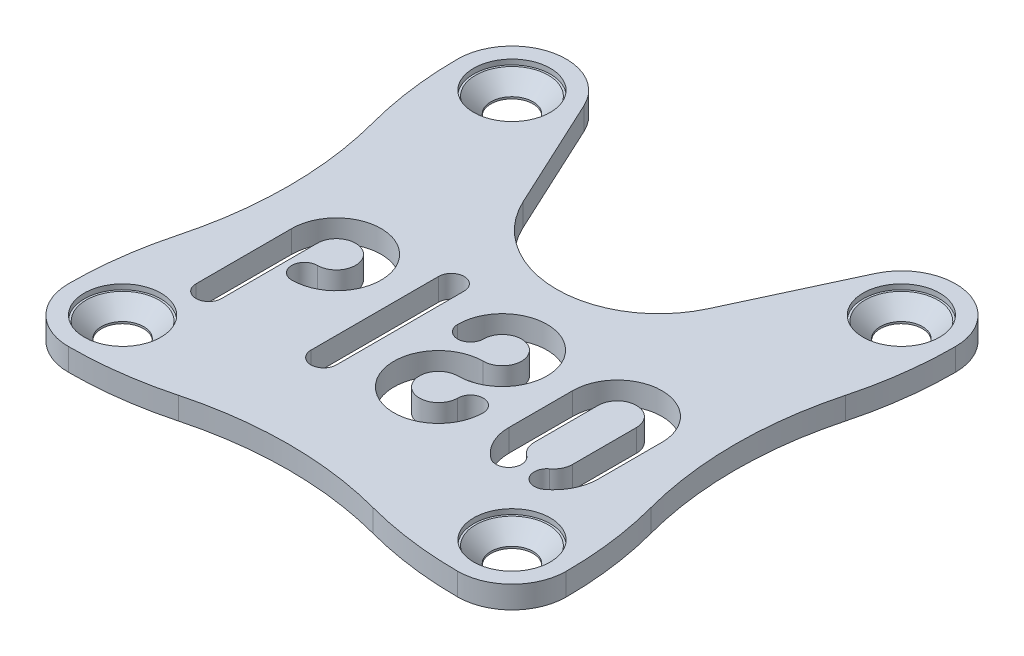
from build123d import *

# Parameters (mm, degrees)
SKETCH1_W                = 39
SKETCH1_H                = 39
SKETCH1_R                = 1.65
SHAPE_DEPTH              = 1.75
CAMERA_CUT_REACH         = 29.633
SKETCH4_R                = 3
SCREW_HEAD_CUTS_DEPTH    = 0.4
SCREW_HEAD_CHAMFERS_SIZE = 1.2
BEAUTY_CUTS_REACH        = 29.633
NAME_REACH               = 29.633


with BuildPart() as part:
    # Sketch1 → Shape (new body)
    with BuildSketch(Plane(origin=(0, 0, 0), x_dir=(1, 0, 0), z_dir=(0, 1, 0))):
        Rectangle(SKETCH1_W, SKETCH1_H)
        with Locations((-15.25, 15.25)):
            Circle(SKETCH1_R, mode=Mode.SUBTRACT)
        with Locations((15.25, 15.25)):
            Circle(SKETCH1_R, mode=Mode.SUBTRACT)
        with Locations((-15.25, -15.25)):
            Circle(SKETCH1_R, mode=Mode.SUBTRACT)
        with Locations((15.25, -15.25)):
            Circle(SKETCH1_R, mode=Mode.SUBTRACT)
    extrude(amount=SHAPE_DEPTH)

    # Sketch2 → Camera cut (cut, up to next)
    with BuildSketch(Plane(origin=(0, 1.75, 0), x_dir=(1, 0, 0), z_dir=(0, 1, 0)), mode=Mode.PRIVATE) as camera_cut_sk1:
        with BuildLine():
            ThreePointArc((-7.255139017, 8.12910133), (0, 3.5), (7.255139017, 8.12910133))
            Line((7.255139017, 8.12910133), (11.395707531, 17.040790207))
            ThreePointArc((11.395707531, 17.040790207), (12.963994574, 18.83283117), (15.25, 19.5))
            Line((15.25, 19.5), (-15.249999971, 19.5))
            ThreePointArc((-15.249999971, 19.5), (-12.963994499, 18.832831122), (-11.395707469, 17.040790074))
            Line((-11.395707469, 17.040790074), (-7.255139017, 8.12910133))
        make_face()
    camera_cut_tool1 = extrude(camera_cut_sk1.sketch, amount=-CAMERA_CUT_REACH, mode=Mode.PRIVATE) & part.part
    # Sketch2 → Camera cut (cut, up to next)
    with BuildSketch(Plane(origin=(0, 1.75, 0), x_dir=(1, 0, 0), z_dir=(0, 1, 0)), mode=Mode.PRIVATE) as camera_cut_sk2:
        with BuildLine():
            ThreePointArc((-19.5, 15.25), (-18.25520381, 18.25520383), (-15.249999971, 19.5))
            Line((-15.249999971, 19.5), (-19.5, 19.5))
            Line((-19.5, 19.5), (-19.5, 15.25))
        make_face()
    camera_cut_tool2 = extrude(camera_cut_sk2.sketch, amount=-CAMERA_CUT_REACH, mode=Mode.PRIVATE) & part.part
    # Sketch2 → Camera cut (cut, up to next)
    with BuildSketch(Plane(origin=(0, 1.75, 0), x_dir=(1, 0, 0), z_dir=(0, 1, 0)), mode=Mode.PRIVATE) as camera_cut_sk3:
        with BuildLine():
            Line((19.5, 19.5), (15.25, 19.5))
            ThreePointArc((15.25, 19.5), (18.25520382, 18.25520382), (19.5, 15.25))
            Line((19.5, 15.25), (19.5, 19.5))
        make_face()
    camera_cut_tool3 = extrude(camera_cut_sk3.sketch, amount=-CAMERA_CUT_REACH, mode=Mode.PRIVATE) & part.part
    # Sketch2 → Camera cut (cut, up to next)
    with BuildSketch(Plane(origin=(0, 1.75, 0), x_dir=(1, 0, 0), z_dir=(0, 1, 0)), mode=Mode.PRIVATE) as camera_cut_sk4:
        with BuildLine():
            ThreePointArc((-15.25, -19.5), (-18.255203845, -18.255203795), (-19.5, -15.249999928))
            Line((-19.5, -15.249999928), (-19.5, -19.5))
            Line((-19.5, -19.5), (-15.25, -19.5))
        make_face()
    camera_cut_tool4 = extrude(camera_cut_sk4.sketch, amount=-CAMERA_CUT_REACH, mode=Mode.PRIVATE) & part.part
    # Sketch2 → Camera cut (cut, up to next)
    with BuildSketch(Plane(origin=(0, 1.75, 0), x_dir=(1, 0, 0), z_dir=(0, 1, 0)), mode=Mode.PRIVATE) as camera_cut_sk5:
        with BuildLine():
            Line((19.5, -19.5), (19.5, -15.25))
            ThreePointArc((19.5, -15.25), (18.255203817, -18.255203823), (15.249999992, -19.5))
            Line((15.249999992, -19.5), (19.5, -19.5))
        make_face()
    camera_cut_tool5 = extrude(camera_cut_sk5.sketch, amount=-CAMERA_CUT_REACH, mode=Mode.PRIVATE) & part.part
    add(camera_cut_tool1.solids().sort_by_distance((0, 1.75, -12.946988))[0], mode=Mode.SUBTRACT)
    add(camera_cut_tool2.solids().sort_by_distance((-18.550686, 1.75, -18.550686))[0], mode=Mode.SUBTRACT)
    add(camera_cut_tool3.solids().sort_by_distance((18.550686, 1.75, -18.550686))[0], mode=Mode.SUBTRACT)
    add(camera_cut_tool4.solids().sort_by_distance((-18.550686, 1.75, 18.550686))[0], mode=Mode.SUBTRACT)
    add(camera_cut_tool5.solids().sort_by_distance((18.550686, 1.75, 18.550686))[0], mode=Mode.SUBTRACT)

    # Sketch4 → Screw head cuts (cut)
    with BuildSketch(Plane(origin=(0, 1.75, 0), x_dir=(1, 0, 0), z_dir=(0, 1, 0))):
        with Locations((-15.25, 15.25)):
            Circle(SKETCH4_R)
        with Locations((15.25, 15.25)):
            Circle(SKETCH4_R)
        with Locations((15.25, -15.25)):
            Circle(SKETCH4_R)
        with Locations((-15.25, -15.25)):
            Circle(SKETCH4_R)
    extrude(amount=-SCREW_HEAD_CUTS_DEPTH, mode=Mode.SUBTRACT)

    # Screw head chamfers
    screw_head_chamfers_edges = [part.edges().sort_by_distance(p)[0] for p in [
        (-16.9, 1.35, 15.25),
        (13.6, 1.35, 15.25),
        (13.6, 1.35, -15.25),
        (-16.9, 1.35, -15.25),
    ]]
    chamfer(screw_head_chamfers_edges, length=SCREW_HEAD_CHAMFERS_SIZE)

    # Sketch5 → Beauty cuts (cut, up to next)
    with BuildSketch(Plane(origin=(0, 1.75, 0), x_dir=(1, 0, 0), z_dir=(0, 1, 0)), mode=Mode.PRIVATE) as beauty_cuts_sk1:
        with BuildLine():
            Line((-19.5, 15.25), (-19.5, -15.25))
            ThreePointArc((-19.5, -15.25), (-19.248934167, -11.404852896), (-18.5, -7.625))
            ThreePointArc((-18.5, -7.625), (-17.5, 0), (-18.5, 7.625))
            ThreePointArc((-18.5, 7.625), (-19.248934167, 11.404852896), (-19.5, 15.25))
        make_face()
    beauty_cuts_tool1 = extrude(beauty_cuts_sk1.sketch, amount=-BEAUTY_CUTS_REACH, mode=Mode.PRIVATE) & part.part
    # Sketch5 → Beauty cuts (cut, up to next)
    with BuildSketch(Plane(origin=(0, 1.75, 0), x_dir=(1, 0, 0), z_dir=(0, 1, 0)), mode=Mode.PRIVATE) as beauty_cuts_sk2:
        with BuildLine():
            Line((-15.25, -19.5), (15.25, -19.5))
            ThreePointArc((15.25, -19.5), (11.404852896, -19.248934167), (7.625, -18.5))
            ThreePointArc((7.625, -18.5), (0, -17.5), (-7.625, -18.5))
            ThreePointArc((-7.625, -18.5), (-11.404852896, -19.248934167), (-15.25, -19.5))
        make_face()
    beauty_cuts_tool2 = extrude(beauty_cuts_sk2.sketch, amount=-BEAUTY_CUTS_REACH, mode=Mode.PRIVATE) & part.part
    # Sketch5 → Beauty cuts (cut, up to next)
    with BuildSketch(Plane(origin=(0, 1.75, 0), x_dir=(1, 0, 0), z_dir=(0, 1, 0)), mode=Mode.PRIVATE) as beauty_cuts_sk3:
        with BuildLine():
            Line((19.5, -15.25), (19.5, 15.25))
            ThreePointArc((19.5, 15.25), (19.248934167, 11.404852896), (18.5, 7.625))
            ThreePointArc((18.5, 7.625), (17.5, 0), (18.5, -7.625))
            ThreePointArc((18.5, -7.625), (19.248934167, -11.404852896), (19.5, -15.25))
        make_face()
    beauty_cuts_tool3 = extrude(beauty_cuts_sk3.sketch, amount=-BEAUTY_CUTS_REACH, mode=Mode.PRIVATE) & part.part
    add(beauty_cuts_tool1.solids().sort_by_distance((-18.732027, 1.75, 0))[0], mode=Mode.SUBTRACT)
    add(beauty_cuts_tool2.solids().sort_by_distance((0, 1.75, 18.732027))[0], mode=Mode.SUBTRACT)
    add(beauty_cuts_tool3.solids().sort_by_distance((18.732027, 1.75, 0))[0], mode=Mode.SUBTRACT)

    # Sketch9 → Name (cut, up to next)
    with BuildSketch(Plane(origin=(0, 1.75, 0), x_dir=(1, 0, 0), z_dir=(0, 1, 0)), mode=Mode.PRIVATE) as name_sk1:
        with BuildLine():
            Line((-14.5, -2.75), (-14.5, -10.25))
            ThreePointArc((-14.5, -10.25), (-13.5, -11.25), (-12.5, -10.25))
            Line((-12.5, -10.25), (-12.5, -2.75))
            ThreePointArc((-12.5, -2.75), (-9.939339828, -1.689339828), (-11, -4.25))
            ThreePointArc((-11, -4.25), (-12, -5.250000005), (-10.999999989, -6.25))
            ThreePointArc((-10.999999989, -6.25), (-8.52512627, -0.275126262), (-14.5, -2.75))
        make_face()
    name_tool1 = extrude(name_sk1.sketch, amount=-NAME_REACH, mode=Mode.PRIVATE) & part.part
    # Sketch9 → Name (cut, up to next)
    with BuildSketch(Plane(origin=(0, 1.75, 0), x_dir=(1, 0, 0), z_dir=(0, 1, 0)), mode=Mode.PRIVATE) as name_sk2:
        with BuildLine():
            Line((-3.5, -10.25), (-3.5, -0.25))
            ThreePointArc((-3.5, -0.25), (-4.5, 0.75), (-5.5, -0.25))
            Line((-5.5, -0.25), (-5.5, -10.25))
            ThreePointArc((-5.5, -10.25), (-4.5, -11.25), (-3.5, -10.25))
        make_face()
    name_tool2 = extrude(name_sk2.sketch, amount=-NAME_REACH, mode=Mode.PRIVATE) & part.part
    # Sketch9 → Name (cut, up to next)
    with BuildSketch(Plane(origin=(0, 1.75, 0), x_dir=(1, 0, 0), z_dir=(0, 1, 0)), mode=Mode.PRIVATE) as name_sk3:
        with BuildLine():
            Line((7.5, -2.75), (7.5, -7.75))
            ThreePointArc((7.5, -7.75), (7.869504796, -9.315247513), (8.899999873, -10.549999905))
            ThreePointArc((8.899999873, -10.549999905), (10.299999948, -10.35000007), (10.100000013, -8.950000009))
            ThreePointArc((10.100000013, -8.950000009), (9.658359217, -8.4208204), (9.5, -7.75))
            Line((9.5, -7.75), (9.5, -2.75))
            ThreePointArc((9.5, -2.75), (11, -1.25), (12.5, -2.75))
            Line((12.5, -2.75), (12.5, -7.75))
            ThreePointArc((12.5, -7.75), (12.341640763, -8.420820441), (11.899999915, -8.950000063))
            ThreePointArc((11.899999915, -8.950000063), (11.700000022, -10.350000029), (13.099999973, -10.55000002))
            ThreePointArc((13.099999973, -10.55000002), (14.130495161, -9.315247599), (14.5, -7.75))
            Line((14.5, -7.75), (14.5, -2.75))
            ThreePointArc((14.5, -2.75), (11, 0.75), (7.5, -2.75))
        make_face()
    name_tool3 = extrude(name_sk3.sketch, amount=-NAME_REACH, mode=Mode.PRIVATE) & part.part
    # Sketch9 → Name (cut, up to next)
    with BuildSketch(Plane(origin=(0, 1.75, 0), x_dir=(1, 0, 0), z_dir=(0, 1, 0)), mode=Mode.PRIVATE) as name_sk4:
        with BuildLine():
            ThreePointArc((-1.5, -2.75), (-0.5, -3.75), (0.5, -2.75))
            ThreePointArc((0.5, -2.75), (3.060660171, -1.689339828), (2.000000002, -4.25))
            ThreePointArc((2.000000002, -4.25), (-0.474873735, -10.224873734), (5.5, -7.75))
            ThreePointArc((5.5, -7.75), (4.5, -6.75), (3.5, -7.75))
            ThreePointArc((3.5, -7.75), (0.939339829, -8.810660172), (1.999999998, -6.25))
            ThreePointArc((1.999999998, -6.25), (4.474873735, -0.275126266), (-1.5, -2.75))
        make_face()
    name_tool4 = extrude(name_sk4.sketch, amount=-NAME_REACH, mode=Mode.PRIVATE) & part.part
    add(name_tool1.solids().sort_by_distance((-8.623361, 1.75, 0.373361))[0], mode=Mode.SUBTRACT)
    add(name_tool2.solids().sort_by_distance((-4.5, 1.75, 5.25))[0], mode=Mode.SUBTRACT)
    add(name_tool3.solids().sort_by_distance((14.365371, 1.75, 5.25))[0], mode=Mode.SUBTRACT)
    add(name_tool4.solids().sort_by_distance((2, 1.75, 5.25))[0], mode=Mode.SUBTRACT)


solid = part.part
